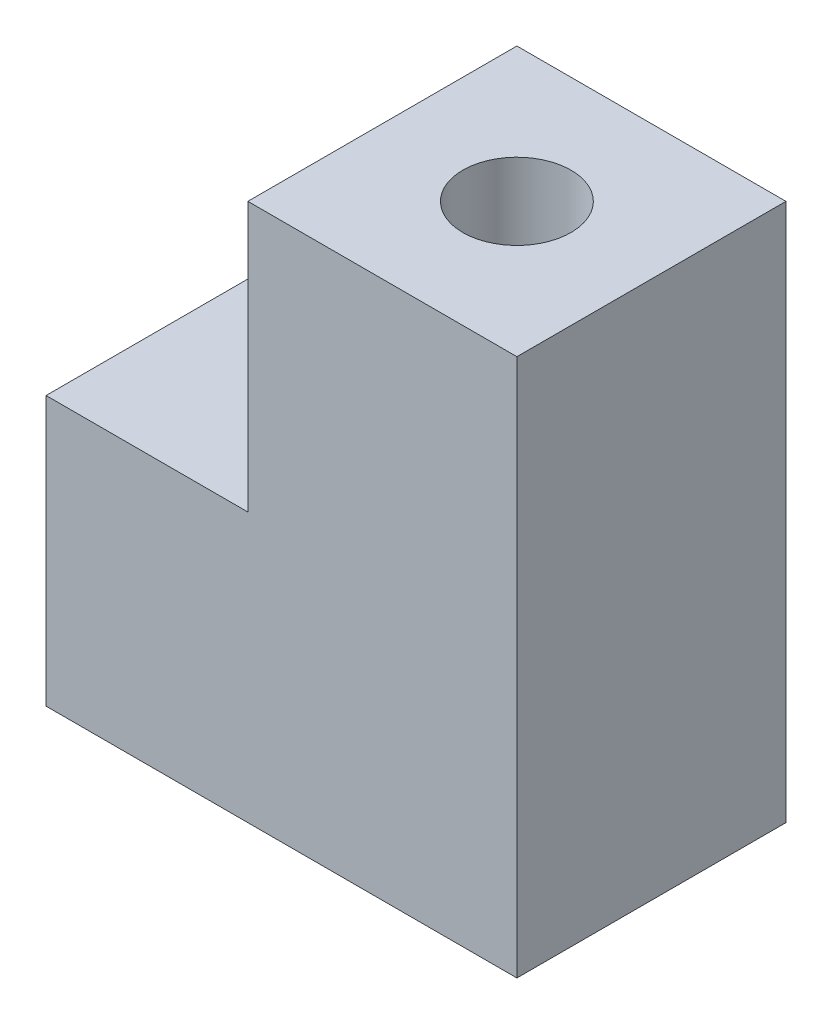
from build123d import *

# Parameters (mm, degrees)
BOSS_EXTRUDE1_DEPTH         = 12.7
F_1_4_20_TAPPED_HOLE1_D     = 5.1054
F_1_4_20_TAPPED_HOLE2_D     = 5.1054
F_1_4_20_TAPPED_HOLE2_DEPTH = 16.51
F_1_4_20_TAPPED_HOLE2_TIP   = 1.533816902


with BuildPart() as part:
    # Sketch1 → Boss-Extrude1 (new body)
    with BuildSketch(Plane.XY):
        Polygon((0, 0), (0, 25.4), (-12.7, 25.4), (-12.7, 12.7), (-22.225, 12.7), (-22.225, 0), align=None)
    extrude(amount=BOSS_EXTRUDE1_DEPTH)

    # 1/4-20 Tapped Hole1 (through all)
    with Locations(Plane(origin=(0, 25.4, 0), x_dir=(1, 0, 0), z_dir=(0, 1, 0))):
        with Locations((-6.35, -6.35)):
            Hole(F_1_4_20_TAPPED_HOLE1_D / 2)

    # 1/4-20 Tapped Hole2
    with Locations(Plane.ZY.offset(22.225)):
        with Locations((6.35, 6.35)):
            Hole(F_1_4_20_TAPPED_HOLE2_D / 2, depth=F_1_4_20_TAPPED_HOLE2_DEPTH)
            with Locations((0, 0, -(F_1_4_20_TAPPED_HOLE2_DEPTH + F_1_4_20_TAPPED_HOLE2_TIP / 2))):  # 118° drill point
                Cone(0, F_1_4_20_TAPPED_HOLE2_D / 2, F_1_4_20_TAPPED_HOLE2_TIP, mode=Mode.SUBTRACT)


solid = part.part
